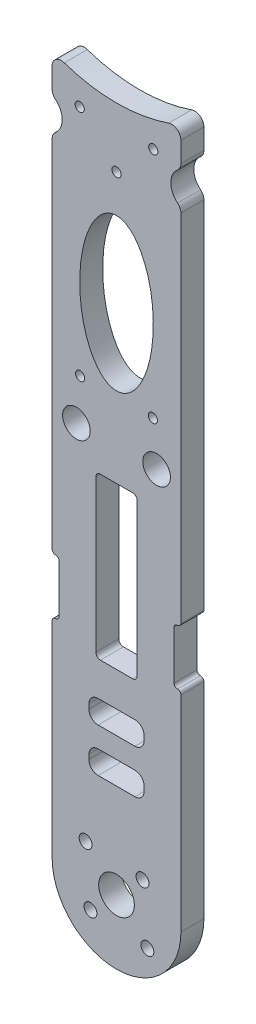
from build123d import *

# Parameters (mm, degrees)
SKETCH1_R           = 1
SKETCH1_R_2         = 1.4
SKETCH1_R_3         = 3
SKETCH1_RX          = 16.5
SKETCH1_RY          = 8
BOSS_EXTRUDE1_DEPTH = 5
CUT_EXTRUDE1_REACH  = 153.803
SKETCH2_R           = 3.875


with BuildPart() as part:
    # Sketch1 → Boss-Extrude1 (new body)
    with BuildSketch(Plane.XY):
        with BuildLine():
            Line((-14, 0), (-14, 44.641437436))
            ThreePointArc((-14, 44.641437436), (-13.783259018, 45.164696454), (-13.26, 45.381437436))
            Line((-13.26, 45.381437436), (-13.24, 45.381437436))
            ThreePointArc((-13.24, 45.381437436), (-12.716740982, 45.598178417), (-12.5, 46.121437436))
            Line((-12.5, 46.121437436), (-12.5, 56.641437436))
            ThreePointArc((-12.5, 56.641437436), (-12.716740982, 57.164696454), (-13.24, 57.381437436))
            Line((-13.24, 57.381437436), (-13.26, 57.381437436))
            ThreePointArc((-13.26, 57.381437436), (-13.783259018, 57.598178417), (-14, 58.121437436))
            Line((-14, 58.121437436), (-14, 135.347392982))
            ThreePointArc((-14, 135.347392982), (-13.809166738, 136.199986504), (-13.273084285, 136.889876824))
            ThreePointArc((-13.273084285, 136.889876824), (-11.805402668, 140.00423401), (-13.273084285, 143.118591196))
            ThreePointArc((-13.273084285, 143.118591196), (-13.809166738, 143.808481515), (-14, 144.661075038))
            Line((-14, 144.661075038), (-14, 149.07320666))
            ThreePointArc((-14, 149.07320666), (-13.162476387, 150.700673602), (-11.351351351, 150.965098552))
            ThreePointArc((-11.351351351, 150.965098552), (0, 149.07320666), (11.351351351, 150.965098552))
            ThreePointArc((11.351351351, 150.965098552), (13.162476387, 150.700673602), (14, 149.07320666))
            Line((14, 149.07320666), (14, 144.661075038))
            ThreePointArc((14, 144.661075038), (13.809166738, 143.808481515), (13.273084285, 143.118591196))
            ThreePointArc((13.273084285, 143.118591196), (11.805402668, 140.00423401), (13.273084285, 136.889876824))
            ThreePointArc((13.273084285, 136.889876824), (13.809166738, 136.199986504), (14, 135.347392982))
            Line((14, 135.347392982), (14, 58.121437436))
            ThreePointArc((14, 58.121437436), (13.783259018, 57.598178417), (13.26, 57.381437436))
            Line((13.26, 57.381437436), (13.24, 57.381437436))
            ThreePointArc((13.24, 57.381437436), (12.716740982, 57.164696454), (12.5, 56.641437436))
            Line((12.5, 56.641437436), (12.5, 46.121437436))
            ThreePointArc((12.5, 46.121437436), (12.716740982, 45.598178417), (13.24, 45.381437436))
            Line((13.24, 45.381437436), (13.26, 45.381437436))
            ThreePointArc((13.26, 45.381437436), (13.783259018, 45.164696454), (14, 44.641437436))
            Line((14, 44.641437436), (14, 0))
            ThreePointArc((14, 0), (0, -14), (-14, 0))
        make_face()
        with Locations((-8, 144.371191598)):
            Circle(SKETCH1_R, mode=Mode.SUBTRACT)
        with Locations((6.717514421, -6.717514421)):
            Circle(SKETCH1_R_2, mode=Mode.SUBTRACT)
        with Locations((-5.656854249, -5.656854249)):
            Circle(SKETCH1_R_2, mode=Mode.SUBTRACT)
        with Locations((5.656854249, 5.656854249)):
            Circle(SKETCH1_R_2, mode=Mode.SUBTRACT)
        with Locations((-6.717514421, 6.717514421)):
            Circle(SKETCH1_R_2, mode=Mode.SUBTRACT)
        with Locations((8, 144.371191598)):
            Circle(SKETCH1_R, mode=Mode.SUBTRACT)
        with Locations((0, 136.07320666)):
            Circle(SKETCH1_R, mode=Mode.SUBTRACT)
        with Locations((-7.903282752, 93.738271437)):
            Circle(SKETCH1_R, mode=Mode.SUBTRACT)
        with Locations((-8.715574275, 84.453736851)):
            Circle(SKETCH1_R_3, mode=Mode.SUBTRACT)
        with Locations((7.903282752, 93.738271437)):
            Circle(SKETCH1_R, mode=Mode.SUBTRACT)
        with Locations((8.715574275, 84.453736851)):
            Circle(SKETCH1_R_3, mode=Mode.SUBTRACT)
        with Locations(Location((0, 111.383897204), (0, 0, 90))):
            Ellipse(SKETCH1_RX, SKETCH1_RY, mode=Mode.SUBTRACT)
        with BuildLine():
            Line((-4, 29.983897204), (4, 29.983897204))
            ThreePointArc((4, 29.983897204), (5.414213562, 30.569683642), (6, 31.983897204))
            Line((6, 31.983897204), (6, 32.983897204))
            ThreePointArc((6, 32.983897204), (5.414213562, 34.398110767), (4, 34.983897204))
            Line((4, 34.983897204), (-4, 34.983897204))
            ThreePointArc((-4, 34.983897204), (-5.414213562, 34.398110767), (-6, 32.983897204))
            Line((-6, 32.983897204), (-6, 31.983897204))
            ThreePointArc((-6, 31.983897204), (-5.414213562, 30.569683642), (-4, 29.983897204))
        make_face(mode=Mode.SUBTRACT)
        with BuildLine():
            Line((-4, 20.483897204), (4, 20.483897204))
            ThreePointArc((4, 20.483897204), (5.414213562, 21.069683642), (6, 22.483897204))
            Line((6, 22.483897204), (6, 23.483897204))
            ThreePointArc((6, 23.483897204), (5.414213562, 24.898110767), (4, 25.483897204))
            Line((4, 25.483897204), (-4, 25.483897204))
            ThreePointArc((-4, 25.483897204), (-5.414213562, 24.898110767), (-6, 23.483897204))
            Line((-6, 23.483897204), (-6, 22.483897204))
            ThreePointArc((-6, 22.483897204), (-5.414213562, 21.069683642), (-4, 20.483897204))
        make_face(mode=Mode.SUBTRACT)
        with BuildLine():
            Line((-3.5, 42.443937436), (3.5, 42.443937436))
            ThreePointArc((3.5, 42.443937436), (4.207106781, 42.736830654), (4.5, 43.443937436))
            Line((4.5, 43.443937436), (4.5, 76.443937436))
            ThreePointArc((4.5, 76.443937436), (4.207106781, 77.151044217), (3.5, 77.443937436))
            Line((3.5, 77.443937436), (-3.5, 77.443937436))
            ThreePointArc((-3.5, 77.443937436), (-4.207106781, 77.151044217), (-4.5, 76.443937436))
            Line((-4.5, 76.443937436), (-4.5, 43.443937436))
            ThreePointArc((-4.5, 43.443937436), (-4.207106781, 42.736830654), (-3.5, 42.443937436))
        make_face(mode=Mode.SUBTRACT)
    extrude(amount=BOSS_EXTRUDE1_DEPTH)

    # Sketch2 → Cut-Extrude1 (cut, up to next)
    with BuildSketch(Plane.XY.offset(5), mode=Mode.PRIVATE) as cut_extrude1_sk1:
        Circle(SKETCH2_R)
    cut_extrude1_tool1 = extrude(cut_extrude1_sk1.sketch, amount=-CUT_EXTRUDE1_REACH, mode=Mode.PRIVATE) & part.part
    add(cut_extrude1_tool1.solids().sort_by_distance((0, 0, 5))[0], mode=Mode.SUBTRACT)


solid = part.part
